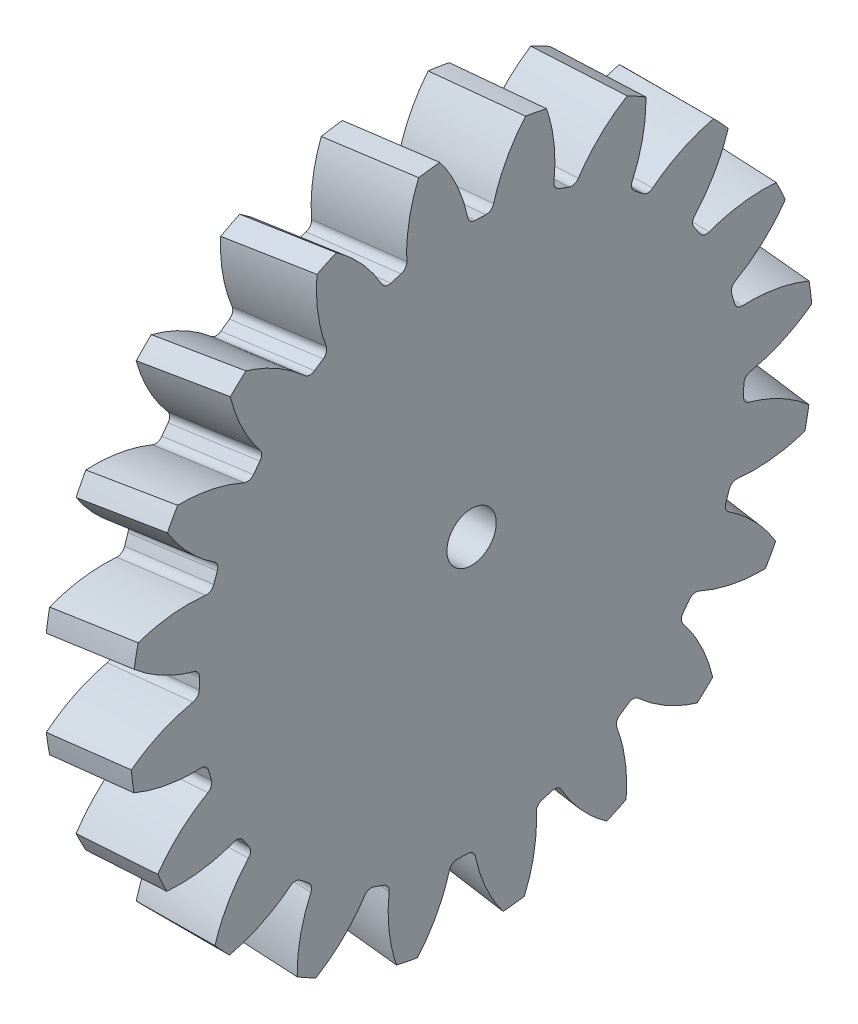
from build123d import *

# Parameters (mm, degrees)
BASPROSKE_W            = 1.4
BASPROSKE_H            = 5.542349015
TOOTHCUTLH_PITCH       = 266.995801813
TOOTHCUTLH_HEIGHT      = 1.4
TOOTHCUTLH_RADIUS      = 5.542349015
TOOTHCUTLH_START_ANGLE = -90
TEETHCUTSLH_COUNT      = 20
TEETHCUTSLH_ANGLE      = 342
BORSKE_R               = 0.4
BORE_DEPTH             = 62.5000025


with BuildPart() as part:
    # BasProSke → Base-Revolve (revolve)
    with BuildSketch(Plane(origin=(0, 0, 0), x_dir=(1, 0, 0), z_dir=(0, 1, 0)), mode=Mode.PRIVATE) as base_revolve_sk:
        with Locations((0.7, 2.771174508)):
            Rectangle(BASPROSKE_W, BASPROSKE_H)
    revolve(base_revolve_sk.sketch.rotate(Axis((-10, 0, 0), (1, 0, 0)), 180), axis=Axis((-10, 0, 0), (1, 0, 0)))

    # ToothCutLH: sweep along a helix
    with BuildLine() as toothcutlh_path:
        add(Helix(TOOTHCUTLH_PITCH, TOOTHCUTLH_HEIGHT, TOOTHCUTLH_RADIUS, center=(0, 0, 0), direction=(1, 0, 0), lefthand=True, mode=Mode.PRIVATE).rotate(Axis((0, 0, 0), (1, 0, 0)), TOOTHCUTLH_START_ANGLE))
    # TooCutSkeRH<3> → ToothCutLH (sweep, cut)
    with BuildSketch(Plane(origin=(0, 0, 0), x_dir=(0, 0, -1), z_dir=(1, 0, 0))):
        with BuildLine():
            ThreePointArc((0.085337948, 4.416524624), (0, 4.417349015), (-0.085337948, 4.416524624))
            ThreePointArc((-0.085337948, 4.416524624), (-0.164796484, 4.442785277), (-0.210277743, 4.513032954))
            ThreePointArc((-0.210277743, 4.513032954), (-0.443902543, 5.121245054), (-0.826751339, 5.648435062))
            ThreePointArc((-0.826751339, 5.648435062), (0, 5.708619485), (0.826751339, 5.648435062))
            ThreePointArc((0.826751339, 5.648435062), (0.443902543, 5.121245054), (0.210277743, 4.513032954))
            ThreePointArc((0.210277743, 4.513032954), (0.164796484, 4.442785277), (0.085337948, 4.416524624))
        make_face()
    toothcutlh = sweep(path=toothcutlh_path.line, is_frenet=True, mode=Mode.SUBTRACT)

    # TeethCutsLH: ToothCutLH ×20 about axis
    teethcutslh_axis = Axis((-10, 0, 0), (1, 0, 0))
    for i in range(1, TEETHCUTSLH_COUNT):
        add(toothcutlh.rotate(teethcutslh_axis, i * TEETHCUTSLH_ANGLE / (TEETHCUTSLH_COUNT - 1)), mode=Mode.SUBTRACT)

    # BorSke → Bore (cut, symmetric)
    with BuildSketch(Plane(origin=(0, 0, 0), x_dir=(0, 0, -1), z_dir=(1, 0, 0))):
        with Locations(Location((0, 0, 0), (0, 0, 180))):
            Circle(BORSKE_R)
    extrude(amount=BORE_DEPTH, both=True, mode=Mode.SUBTRACT)


solid = part.part
